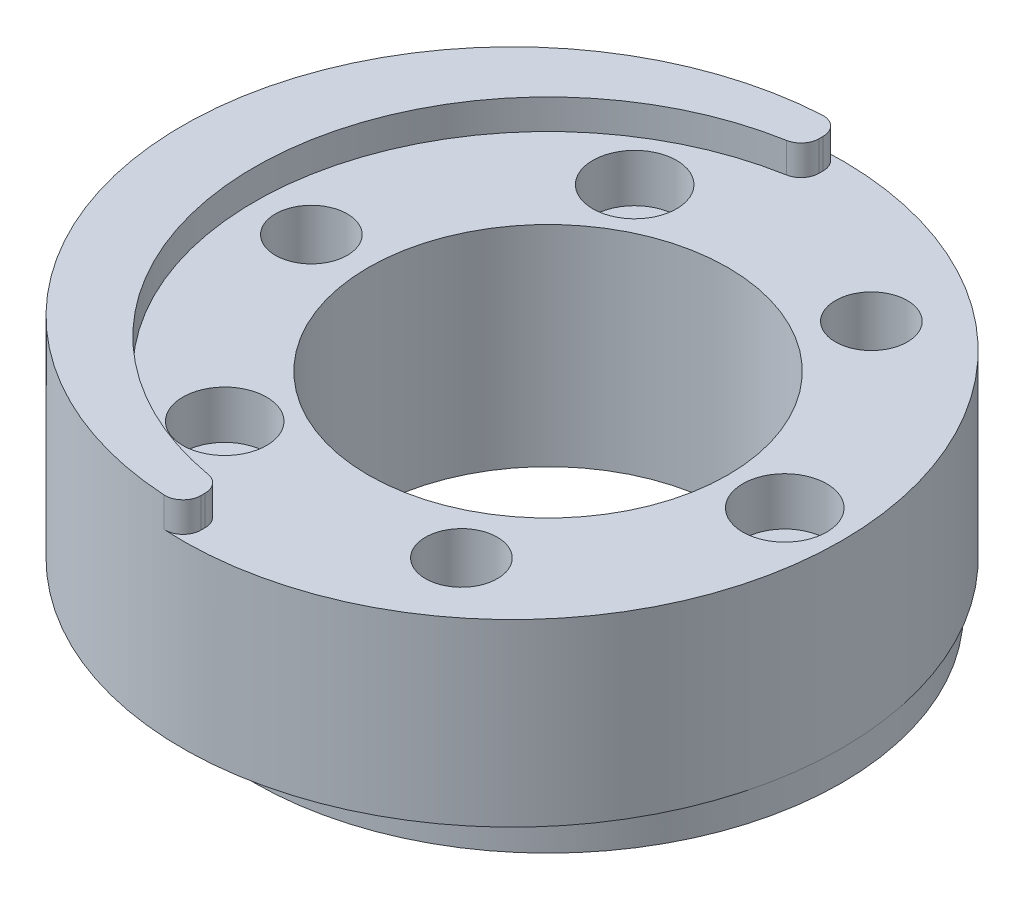
from build123d import *

# Parameters (mm, degrees)
SKETCH1_R           = 27.5
BOSS_EXTRUDE1_DEPTH = 15
BOSS_EXTRUDE3_DEPTH = 2.5
FILLET2_R           = 1.5
SKETCH4_R           = 3
CUT_EXTRUDE1_DEPTH  = 5
SKETCH5_R           = 15
CUT_EXTRUDE2_DEPTH  = 15
SKETCH7_R           = 24.5
SKETCH7_R_2         = 15
BOSS_EXTRUDE6_DEPTH = 2.5
SKETCH8_R           = 2
CUT_EXTRUDE3_DEPTH  = 17.5
SKETCH9_R           = 3.5
SKETCH9_R_2         = 2
CUT_EXTRUDE4_DEPTH  = 4
SKETCH10_R          = 2
CUT_EXTRUDE5_DEPTH  = 2.5


with BuildPart() as part:
    # Sketch1 → Boss-Extrude1 (new body)
    with BuildSketch(Plane(origin=(0, 0, 0), x_dir=(1, 0, 0), z_dir=(0, 1, 0))):
        Circle(SKETCH1_R)
    extrude(amount=BOSS_EXTRUDE1_DEPTH)

    # Sketch3 → Boss-Extrude3 (add)
    with BuildSketch(Plane(origin=(0, 15, 0), x_dir=(1, 0, 0), z_dir=(0, 1, 0))):
        with BuildLine():
            ThreePointArc((0, -24.315632832), (-21.5, 0), (0, 24.315632832))
            Line((0, 24.315632832), (0, 27.5))
            ThreePointArc((0, 27.5), (-27.5, 0), (0, -27.5))
            Line((0, -27.5), (0, -24.315632832))
        make_face()
    extrude(amount=BOSS_EXTRUDE3_DEPTH)

    # Fillet2
    fillet2_edges = [part.edges().sort_by_distance(p)[0] for p in [
        (0, 16.25, -27.5),
        (0, 16.25, -24.315632832),
        (0, 16.25, 24.315632832),
        (0, 16.25, 27.5),
    ]]
    fillet(fillet2_edges, radius=FILLET2_R)

    # Sketch4 → Cut-Extrude1 (cut)
    with BuildSketch(Plane(origin=(0, 15, 0), x_dir=(1, 0, 0), z_dir=(0, 1, 0))):
        with Locations((-16.75, 0)):
            Circle(SKETCH4_R)
        with Locations((12.875, 17.104001725)):
            Circle(SKETCH4_R)
        with Locations((12.875, -17.104001725)):
            Circle(SKETCH4_R)
    extrude(amount=-CUT_EXTRUDE1_DEPTH, mode=Mode.SUBTRACT)

    # Sketch5 → Cut-Extrude2 (cut)
    with BuildSketch(Plane(origin=(0, 15, 0), x_dir=(1, 0, 0), z_dir=(0, 1, 0))):
        with Locations((3, 0)):
            Circle(SKETCH5_R)
    extrude(amount=-CUT_EXTRUDE2_DEPTH, mode=Mode.SUBTRACT)

    # Sketch7 → Boss-Extrude6 (add)
    with BuildSketch(Plane.XZ):
        with Locations((3, 0)):
            Circle(SKETCH7_R)
        with Locations((3, 0)):
            Circle(SKETCH7_R_2, mode=Mode.SUBTRACT)
    extrude(amount=BOSS_EXTRUDE6_DEPTH)

    # Sketch8 → Cut-Extrude3 (cut)
    with BuildSketch(Plane(origin=(0, 15, 0), x_dir=(1, 0, 0), z_dir=(0, 1, 0))):
        with Locations((-6.875, 17.104001725)):
            Circle(SKETCH8_R)
        with Locations((22.75, 0)):
            Circle(SKETCH8_R)
        with Locations((-6.875, -17.104001725)):
            Circle(SKETCH8_R)
    extrude(amount=-CUT_EXTRUDE3_DEPTH, mode=Mode.SUBTRACT)

    # Sketch9 → Cut-Extrude4 (cut)
    # profile 1 of 3: a face of its own
    with BuildSketch(Plane(origin=(0, 15, 0), x_dir=(1, 0, 0), z_dir=(0, 1, 0))):
        with Locations((-6.875, 17.104001725)):
            Circle(SKETCH9_R)
        with Locations((-6.875, 17.104001725)):
            Circle(SKETCH9_R_2, mode=Mode.SUBTRACT)
    # profile 2 of 3: a face of its own
    with BuildSketch(Plane(origin=(0, 15, 0), x_dir=(1, 0, 0), z_dir=(0, 1, 0))):
        with Locations((22.75, 0)):
            Circle(SKETCH9_R)
        with Locations((22.75, 0)):
            Circle(SKETCH9_R_2, mode=Mode.SUBTRACT)
    # profile 3 of 3: a face of its own
    with BuildSketch(Plane(origin=(0, 15, 0), x_dir=(1, 0, 0), z_dir=(0, 1, 0))):
        with Locations((-6.875, -17.104001725)):
            Circle(SKETCH9_R)
        with Locations((-6.875, -17.104001725)):
            Circle(SKETCH9_R_2, mode=Mode.SUBTRACT)
    extrude(amount=-CUT_EXTRUDE4_DEPTH, mode=Mode.SUBTRACT)

    # Sketch10 → Cut-Extrude5 (cut)
    with BuildSketch(Plane(origin=(0, 10, 0), x_dir=(1, 0, 0), z_dir=(0, 1, 0))):
        with Locations((-16.75, 0)):
            Circle(SKETCH10_R)
        with Locations((12.875, 17.104001725)):
            Circle(SKETCH10_R)
        with Locations((12.875, -17.104001725)):
            Circle(SKETCH10_R)
    extrude(amount=-CUT_EXTRUDE5_DEPTH, mode=Mode.SUBTRACT)


solid = part.part
